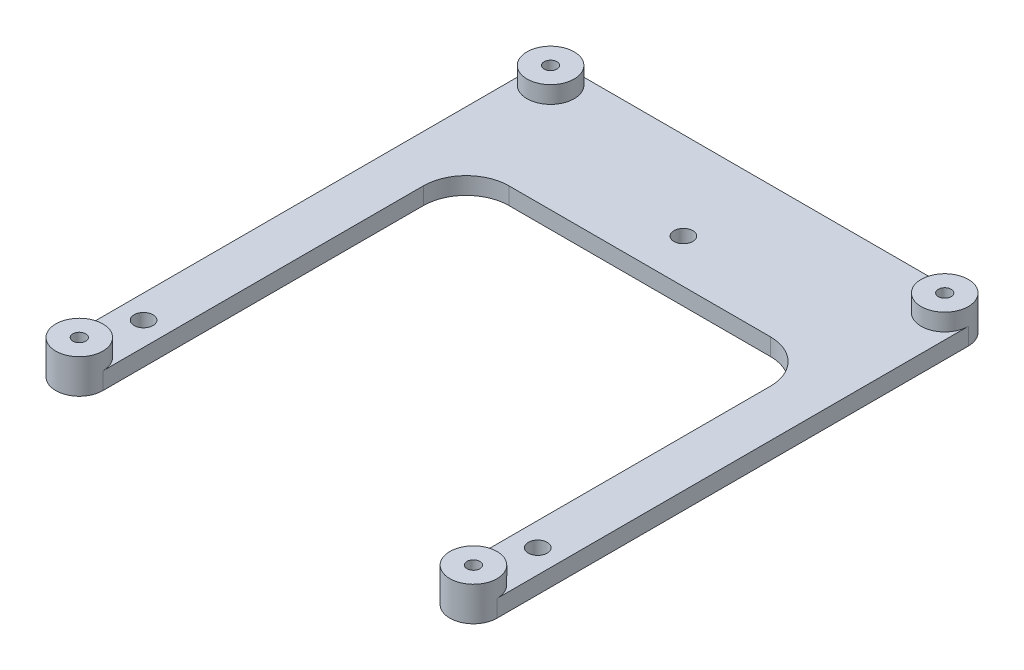
from build123d import *
from build123d.topology import SkipClean

# Parameters (mm, degrees)
SKETCH2_W               = 54
SKETCH2_H               = 63
SKETCH2_R               = 0.75
BOSS_EXTRUDE1_DEPTH     = 2
CUT_EXTRUDE2_DEPTH      = 72.807033082
CUT_EXTRUDE2_DEPTH_BACK = 72.807033082
SKETCH1_R               = 1.1
SKETCH3_R               = 2.75
SKETCH3_R_2             = 0.75
BOSS_EXTRUDE2_DEPTH     = 2
CUT_EXTRUDE3_DEPTH      = 72.807033082
CUT_EXTRUDE3_DEPTH_BACK = 72.807033082
SKETCH4_OUTSIDE_W       = 72.614
SKETCH4_OUTSIDE_H       = 81.614
CUT_EXTRUDE4_DEPTH      = 71.040167047
CUT_EXTRUDE4_DEPTH_BACK = 71.040167047
FILLET1_R               = 5


with BuildPart() as part:
    # Sketch2 → Boss-Extrude1 (new body)
    with BuildSketch(Plane(origin=(0, 0, 0), x_dir=(1, 0, 0), z_dir=(0, 1, 0))):
        with Locations((23, 20)):
            Rectangle(SKETCH2_W, SKETCH2_H)
        with Locations((46, -7.5)):
            Circle(SKETCH2_R, mode=Mode.SUBTRACT)
        with Locations((46, 47.5)):
            Circle(SKETCH2_R, mode=Mode.SUBTRACT)
        with Locations((0, 47.5)):
            Circle(SKETCH2_R, mode=Mode.SUBTRACT)
        with Locations((0, -7.5)):
            Circle(SKETCH2_R, mode=Mode.SUBTRACT)
    extrude(amount=BOSS_EXTRUDE1_DEPTH)

    # Sketch1 → Cut-Extrude2 (cut, two sides: drawn at the far end of the back side and taken through both)
    with BuildSketch(Plane(origin=(0, 0, 0), x_dir=(1, 0, 0), z_dir=(0, 1, 0)).offset(-CUT_EXTRUDE2_DEPTH_BACK)):
        Circle(SKETCH1_R)
        with Locations((46, 0)):
            Circle(SKETCH1_R)
        with Locations((23, 40)):
            Circle(SKETCH1_R)
    extrude(amount=CUT_EXTRUDE2_DEPTH + CUT_EXTRUDE2_DEPTH_BACK, mode=Mode.SUBTRACT)

    # Sketch3 → Boss-Extrude2 (add)
    # profile 1 of 4: a face of its own
    with BuildSketch(Plane(origin=(0, 2, 0), x_dir=(1, 0, 0), z_dir=(0, 1, 0))):
        with Locations((0, -7.5)):
            Circle(SKETCH3_R)
        with Locations((0, -7.5)):
            Circle(SKETCH3_R_2, mode=Mode.SUBTRACT)
    # profile 2 of 4: a face of its own
    with BuildSketch(Plane(origin=(0, 2, 0), x_dir=(1, 0, 0), z_dir=(0, 1, 0))):
        with Locations((46, -7.5)):
            Circle(SKETCH3_R)
        with Locations((46, -7.5)):
            Circle(SKETCH3_R_2, mode=Mode.SUBTRACT)
    # profile 3 of 4: a face of its own
    with BuildSketch(Plane(origin=(0, 2, 0), x_dir=(1, 0, 0), z_dir=(0, 1, 0))):
        with Locations((46, 47.5)):
            Circle(SKETCH3_R)
        with Locations((46, 47.5)):
            Circle(SKETCH3_R_2, mode=Mode.SUBTRACT)
    # profile 4 of 4: a face of its own
    with BuildSketch(Plane(origin=(0, 2, 0), x_dir=(1, 0, 0), z_dir=(0, 1, 0))):
        with Locations((0, 47.5)):
            Circle(SKETCH3_R)
        with Locations((0, 47.5)):
            Circle(SKETCH3_R_2, mode=Mode.SUBTRACT)
    extrude(amount=BOSS_EXTRUDE2_DEPTH)

    # Sketch4 outside → Cut-Extrude3 (cut, two sides: drawn at the far end of the back side and taken through both)
    with SkipClean():  # the faces are left unmerged after this step: merging them gives an invalid solid
        with BuildSketch(Plane(origin=(0, 2, 0), x_dir=(1, 0, 0), z_dir=(0, 1, 0)).offset(-CUT_EXTRUDE3_DEPTH_BACK)):
            with Locations((23, 20)):
                Rectangle(SKETCH4_OUTSIDE_W, SKETCH4_OUTSIDE_H)
            with BuildLine():
                Line((0, -10.25), (46, -10.25))
                ThreePointArc((46, -10.25), (47.944543648, -9.444543648), (48.75, -7.5))
                Line((48.75, -7.5), (48.75, 47.5))
                ThreePointArc((48.75, 47.5), (47.944543648, 49.444543648), (46, 50.25))
                Line((46, 50.25), (0, 50.25))
                ThreePointArc((0, 50.25), (-1.944543648, 49.444543648), (-2.75, 47.5))
                Line((-2.75, 47.5), (-2.75, -7.5))
                ThreePointArc((-2.75, -7.5), (-1.944543648, -9.444543648), (0, -10.25))
            make_face(mode=Mode.SUBTRACT)
        extrude(amount=CUT_EXTRUDE3_DEPTH + CUT_EXTRUDE3_DEPTH_BACK, mode=Mode.SUBTRACT)

    # Sketch5 → Cut-Extrude4 (cut, two sides: drawn at the far end of the back side and taken through both)
    with SkipClean():  # the faces are left unmerged after this step: merging them gives an invalid solid
        with BuildSketch(Plane(origin=(0, 2, 0), x_dir=(1, 0, 0), z_dir=(0, 1, 0)).offset(-CUT_EXTRUDE4_DEPTH_BACK)):
            with BuildLine():
                Line((-165.393854447, -10.25), (0, -10.25))
                ThreePointArc((0, -10.25), (1.944543648, -9.444543648), (2.75, -7.5))
                Line((2.75, -7.5), (2.75, 34.9))
                Line((2.75, 34.9), (43.25, 34.9))
                Line((43.25, 34.9), (43.25, -7.5))
                ThreePointArc((43.25, -7.5), (44.055456352, -9.444543648), (46, -10.25))
                Line((46, -10.25), (211.393854447, -10.25))
                Line((211.393854447, -10.25), (211.393854447, -341.037708895))
                Line((211.393854447, -341.037708895), (-165.393854447, -341.037708895))
                Line((-165.393854447, -341.037708895), (-165.393854447, -10.25))
            make_face()
        extrude(amount=CUT_EXTRUDE4_DEPTH + CUT_EXTRUDE4_DEPTH_BACK, mode=Mode.SUBTRACT)

    # Fillet1
    fillet1_edges = [part.edges().sort_by_distance(p)[0] for p in [
        (43.25, 1, -34.9),
        (2.75, 1, -34.9),
    ]]
    fillet(fillet1_edges, radius=FILLET1_R)


solid = part.part
